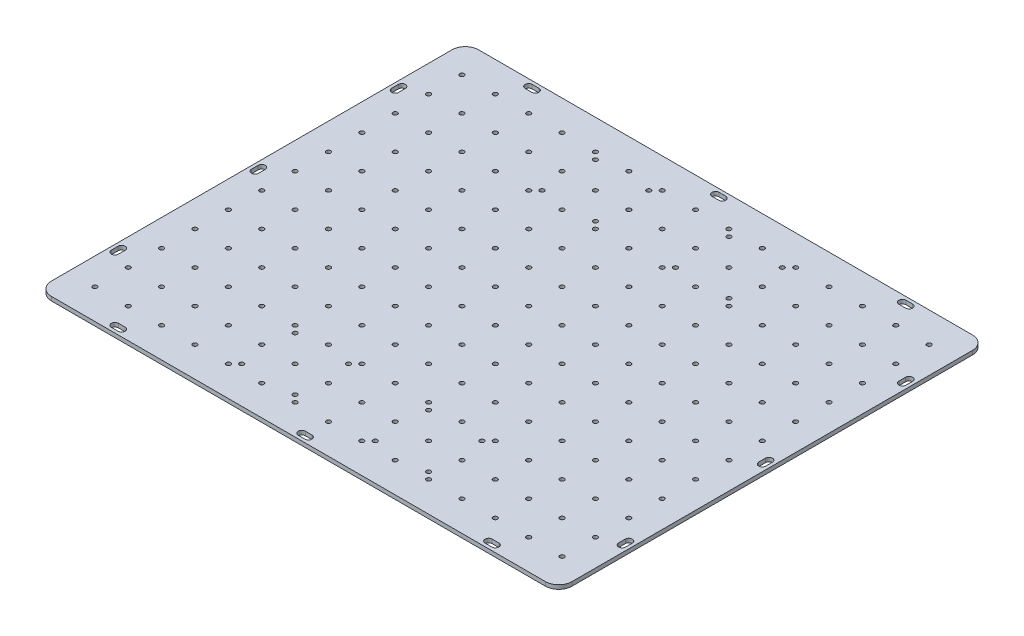
from build123d import *

# Parameters (mm, degrees)
SKETCH1_W           = 390
SKETCH1_H           = 320
BOSS_EXTRUDE1_DEPTH = 3
SKETCH3_R           = 1.65
CUT_EXTRUDE2_DEPTH  = 498.452510296
SKETCH4_R           = 1.65
CUT_EXTRUDE3_DEPTH  = 498.452510296
FILLET1_R           = 10


with BuildPart() as part:
    # Sketch1 → Boss-Extrude1 (new body)
    with BuildSketch(Plane(origin=(0, 0, 0), x_dir=(1, 0, 0), z_dir=(0, 1, 0))):
        with Locations((190, 155)):
            Rectangle(SKETCH1_W, SKETCH1_H)
        with BuildLine():
            Line((52.5, 307.35), (47.5, 307.35))
            ThreePointArc((47.5, 307.35), (44.85, 310), (47.5, 312.65))
            Line((47.5, 312.65), (52.5, 312.65))
            ThreePointArc((52.5, 312.65), (55.15, 310), (52.5, 307.35))
        make_face(mode=Mode.SUBTRACT)
        with BuildLine():
            Line((-2.65, 257.5), (-2.65, 262.5))
            ThreePointArc((-2.65, 262.5), (0, 265.15), (2.65, 262.5))
            Line((2.65, 262.5), (2.65, 257.5))
            ThreePointArc((2.65, 257.5), (0, 254.85), (-2.65, 257.5))
        make_face(mode=Mode.SUBTRACT)
        with BuildLine():
            Line((192.5, 307.35), (187.5, 307.35))
            ThreePointArc((187.5, 307.35), (184.85, 310), (187.5, 312.65))
            Line((187.5, 312.65), (192.5, 312.65))
            ThreePointArc((192.5, 312.65), (195.15, 310), (192.5, 307.35))
        make_face(mode=Mode.SUBTRACT)
        with BuildLine():
            Line((-2.65, 152.5), (-2.65, 157.5))
            ThreePointArc((-2.65, 157.5), (0, 160.15), (2.65, 157.5))
            Line((2.65, 157.5), (2.65, 152.5))
            ThreePointArc((2.65, 152.5), (0, 149.85), (-2.65, 152.5))
        make_face(mode=Mode.SUBTRACT)
        with BuildLine():
            Line((-2.65, 47.5), (-2.65, 52.5))
            ThreePointArc((-2.65, 52.5), (0, 55.15), (2.65, 52.5))
            Line((2.65, 52.5), (2.65, 47.5))
            ThreePointArc((2.65, 47.5), (0, 44.85), (-2.65, 47.5))
        make_face(mode=Mode.SUBTRACT)
        with BuildLine():
            Line((382.65, 257.5), (382.65, 262.5))
            ThreePointArc((382.65, 262.5), (380, 265.15), (377.35, 262.5))
            Line((377.35, 262.5), (377.35, 257.5))
            ThreePointArc((377.35, 257.5), (380, 254.85), (382.65, 257.5))
        make_face(mode=Mode.SUBTRACT)
        with BuildLine():
            Line((382.65, 152.5), (382.65, 157.5))
            ThreePointArc((382.65, 157.5), (380, 160.15), (377.35, 157.5))
            Line((377.35, 157.5), (377.35, 152.5))
            ThreePointArc((377.35, 152.5), (380, 149.85), (382.65, 152.5))
        make_face(mode=Mode.SUBTRACT)
        with BuildLine():
            Line((382.65, 47.5), (382.65, 52.5))
            ThreePointArc((382.65, 52.5), (380, 55.15), (377.35, 52.5))
            Line((377.35, 52.5), (377.35, 47.5))
            ThreePointArc((377.35, 47.5), (380, 44.85), (382.65, 47.5))
        make_face(mode=Mode.SUBTRACT)
        with BuildLine():
            Line((327.5, 307.35), (332.5, 307.35))
            ThreePointArc((332.5, 307.35), (335.15, 310), (332.5, 312.65))
            Line((332.5, 312.65), (327.5, 312.65))
            ThreePointArc((327.5, 312.65), (324.85, 310), (327.5, 307.35))
        make_face(mode=Mode.SUBTRACT)
        with BuildLine():
            Line((52.5, 2.65), (47.5, 2.65))
            ThreePointArc((47.5, 2.65), (44.85, 0), (47.5, -2.65))
            Line((47.5, -2.65), (52.5, -2.65))
            ThreePointArc((52.5, -2.65), (55.15, 0), (52.5, 2.65))
        make_face(mode=Mode.SUBTRACT)
        with BuildLine():
            Line((192.5, 2.65), (187.5, 2.65))
            ThreePointArc((187.5, 2.65), (184.85, 0), (187.5, -2.65))
            Line((187.5, -2.65), (192.5, -2.65))
            ThreePointArc((192.5, -2.65), (195.15, 0), (192.5, 2.65))
        make_face(mode=Mode.SUBTRACT)
        with BuildLine():
            Line((327.5, 2.65), (332.5, 2.65))
            ThreePointArc((332.5, 2.65), (335.15, 0), (332.5, -2.65))
            Line((332.5, -2.65), (327.5, -2.65))
            ThreePointArc((327.5, -2.65), (324.85, 0), (327.5, 2.65))
        make_face(mode=Mode.SUBTRACT)
    extrude(amount=BOSS_EXTRUDE1_DEPTH)

    # Sketch3 → Cut-Extrude2 (cut, through all)
    with BuildSketch(Plane(origin=(0, 3, 0), x_dir=(1, 0, 0), z_dir=(0, 1, 0))):
        with Locations((15, 292.5)):
            Circle(SKETCH3_R)
        with Locations((40, 292.5)):
            Circle(SKETCH3_R)
        with Locations((65, 292.5)):
            Circle(SKETCH3_R)
        with Locations((90, 292.5)):
            Circle(SKETCH3_R)
        with Locations((115, 292.5)):
            Circle(SKETCH3_R)
        with Locations((140, 292.5)):
            Circle(SKETCH3_R)
        with Locations((165, 292.5)):
            Circle(SKETCH3_R)
        with Locations((190, 292.5)):
            Circle(SKETCH3_R)
        with Locations((215, 292.5)):
            Circle(SKETCH3_R)
        with Locations((240, 292.5)):
            Circle(SKETCH3_R)
        with Locations((265, 292.5)):
            Circle(SKETCH3_R)
        with Locations((290, 292.5)):
            Circle(SKETCH3_R)
        with Locations((315, 292.5)):
            Circle(SKETCH3_R)
        with Locations((340, 292.5)):
            Circle(SKETCH3_R)
        with Locations((365, 292.5)):
            Circle(SKETCH3_R)
        with Locations((40, 267.5)):
            Circle(SKETCH3_R)
        with Locations((65, 267.5)):
            Circle(SKETCH3_R)
        with Locations((90, 267.5)):
            Circle(SKETCH3_R)
        with Locations((115, 267.5)):
            Circle(SKETCH3_R)
        with Locations((140, 267.5)):
            Circle(SKETCH3_R)
        with Locations((165, 267.5)):
            Circle(SKETCH3_R)
        with Locations((190, 267.5)):
            Circle(SKETCH3_R)
        with Locations((215, 267.5)):
            Circle(SKETCH3_R)
        with Locations((240, 267.5)):
            Circle(SKETCH3_R)
        with Locations((265, 267.5)):
            Circle(SKETCH3_R)
        with Locations((290, 267.5)):
            Circle(SKETCH3_R)
        with Locations((315, 267.5)):
            Circle(SKETCH3_R)
        with Locations((340, 267.5)):
            Circle(SKETCH3_R)
        with Locations((365, 267.5)):
            Circle(SKETCH3_R)
        with Locations((40, 242.5)):
            Circle(SKETCH3_R)
        with Locations((65, 242.5)):
            Circle(SKETCH3_R)
        with Locations((90, 242.5)):
            Circle(SKETCH3_R)
        with Locations((115, 242.5)):
            Circle(SKETCH3_R)
        with Locations((140, 242.5)):
            Circle(SKETCH3_R)
        with Locations((165, 242.5)):
            Circle(SKETCH3_R)
        with Locations((190, 242.5)):
            Circle(SKETCH3_R)
        with Locations((215, 242.5)):
            Circle(SKETCH3_R)
        with Locations((240, 242.5)):
            Circle(SKETCH3_R)
        with Locations((265, 242.5)):
            Circle(SKETCH3_R)
        with Locations((290, 242.5)):
            Circle(SKETCH3_R)
        with Locations((315, 242.5)):
            Circle(SKETCH3_R)
        with Locations((340, 242.5)):
            Circle(SKETCH3_R)
        with Locations((365, 242.5)):
            Circle(SKETCH3_R)
        with Locations((40, 217.5)):
            Circle(SKETCH3_R)
        with Locations((65, 217.5)):
            Circle(SKETCH3_R)
        with Locations((90, 217.5)):
            Circle(SKETCH3_R)
        with Locations((115, 217.5)):
            Circle(SKETCH3_R)
        with Locations((140, 217.5)):
            Circle(SKETCH3_R)
        with Locations((165, 217.5)):
            Circle(SKETCH3_R)
        with Locations((190, 217.5)):
            Circle(SKETCH3_R)
        with Locations((215, 217.5)):
            Circle(SKETCH3_R)
        with Locations((240, 217.5)):
            Circle(SKETCH3_R)
        with Locations((265, 217.5)):
            Circle(SKETCH3_R)
        with Locations((290, 217.5)):
            Circle(SKETCH3_R)
        with Locations((315, 217.5)):
            Circle(SKETCH3_R)
        with Locations((340, 217.5)):
            Circle(SKETCH3_R)
        with Locations((365, 217.5)):
            Circle(SKETCH3_R)
        with Locations((40, 192.5)):
            Circle(SKETCH3_R)
        with Locations((65, 192.5)):
            Circle(SKETCH3_R)
        with Locations((90, 192.5)):
            Circle(SKETCH3_R)
        with Locations((115, 192.5)):
            Circle(SKETCH3_R)
        with Locations((140, 192.5)):
            Circle(SKETCH3_R)
        with Locations((165, 192.5)):
            Circle(SKETCH3_R)
        with Locations((190, 192.5)):
            Circle(SKETCH3_R)
        with Locations((215, 192.5)):
            Circle(SKETCH3_R)
        with Locations((240, 192.5)):
            Circle(SKETCH3_R)
        with Locations((265, 192.5)):
            Circle(SKETCH3_R)
        with Locations((290, 192.5)):
            Circle(SKETCH3_R)
        with Locations((315, 192.5)):
            Circle(SKETCH3_R)
        with Locations((340, 192.5)):
            Circle(SKETCH3_R)
        with Locations((365, 192.5)):
            Circle(SKETCH3_R)
        with Locations((40, 167.5)):
            Circle(SKETCH3_R)
        with Locations((65, 167.5)):
            Circle(SKETCH3_R)
        with Locations((90, 167.5)):
            Circle(SKETCH3_R)
        with Locations((115, 167.5)):
            Circle(SKETCH3_R)
        with Locations((140, 167.5)):
            Circle(SKETCH3_R)
        with Locations((165, 167.5)):
            Circle(SKETCH3_R)
        with Locations((190, 167.5)):
            Circle(SKETCH3_R)
        with Locations((215, 167.5)):
            Circle(SKETCH3_R)
        with Locations((240, 167.5)):
            Circle(SKETCH3_R)
        with Locations((265, 167.5)):
            Circle(SKETCH3_R)
        with Locations((290, 167.5)):
            Circle(SKETCH3_R)
        with Locations((315, 167.5)):
            Circle(SKETCH3_R)
        with Locations((340, 167.5)):
            Circle(SKETCH3_R)
        with Locations((365, 167.5)):
            Circle(SKETCH3_R)
        with Locations((40, 142.5)):
            Circle(SKETCH3_R)
        with Locations((65, 142.5)):
            Circle(SKETCH3_R)
        with Locations((90, 142.5)):
            Circle(SKETCH3_R)
        with Locations((115, 142.5)):
            Circle(SKETCH3_R)
        with Locations((140, 142.5)):
            Circle(SKETCH3_R)
        with Locations((165, 142.5)):
            Circle(SKETCH3_R)
        with Locations((190, 142.5)):
            Circle(SKETCH3_R)
        with Locations((215, 142.5)):
            Circle(SKETCH3_R)
        with Locations((240, 142.5)):
            Circle(SKETCH3_R)
        with Locations((265, 142.5)):
            Circle(SKETCH3_R)
        with Locations((290, 142.5)):
            Circle(SKETCH3_R)
        with Locations((315, 142.5)):
            Circle(SKETCH3_R)
        with Locations((340, 142.5)):
            Circle(SKETCH3_R)
        with Locations((365, 142.5)):
            Circle(SKETCH3_R)
        with Locations((40, 117.5)):
            Circle(SKETCH3_R)
        with Locations((65, 117.5)):
            Circle(SKETCH3_R)
        with Locations((90, 117.5)):
            Circle(SKETCH3_R)
        with Locations((115, 117.5)):
            Circle(SKETCH3_R)
        with Locations((140, 117.5)):
            Circle(SKETCH3_R)
        with Locations((165, 117.5)):
            Circle(SKETCH3_R)
        with Locations((190, 117.5)):
            Circle(SKETCH3_R)
        with Locations((215, 117.5)):
            Circle(SKETCH3_R)
        with Locations((240, 117.5)):
            Circle(SKETCH3_R)
        with Locations((265, 117.5)):
            Circle(SKETCH3_R)
        with Locations((290, 117.5)):
            Circle(SKETCH3_R)
        with Locations((315, 117.5)):
            Circle(SKETCH3_R)
        with Locations((340, 117.5)):
            Circle(SKETCH3_R)
        with Locations((365, 117.5)):
            Circle(SKETCH3_R)
        with Locations((40, 92.5)):
            Circle(SKETCH3_R)
        with Locations((65, 92.5)):
            Circle(SKETCH3_R)
        with Locations((90, 92.5)):
            Circle(SKETCH3_R)
        with Locations((115, 92.5)):
            Circle(SKETCH3_R)
        with Locations((140, 92.5)):
            Circle(SKETCH3_R)
        with Locations((165, 92.5)):
            Circle(SKETCH3_R)
        with Locations((190, 92.5)):
            Circle(SKETCH3_R)
        with Locations((215, 92.5)):
            Circle(SKETCH3_R)
        with Locations((240, 92.5)):
            Circle(SKETCH3_R)
        with Locations((265, 92.5)):
            Circle(SKETCH3_R)
        with Locations((290, 92.5)):
            Circle(SKETCH3_R)
        with Locations((315, 92.5)):
            Circle(SKETCH3_R)
        with Locations((340, 92.5)):
            Circle(SKETCH3_R)
        with Locations((365, 92.5)):
            Circle(SKETCH3_R)
        with Locations((40, 67.5)):
            Circle(SKETCH3_R)
        with Locations((65, 67.5)):
            Circle(SKETCH3_R)
        with Locations((90, 67.5)):
            Circle(SKETCH3_R)
        with Locations((115, 67.5)):
            Circle(SKETCH3_R)
        with Locations((140, 67.5)):
            Circle(SKETCH3_R)
        with Locations((165, 67.5)):
            Circle(SKETCH3_R)
        with Locations((190, 67.5)):
            Circle(SKETCH3_R)
        with Locations((215, 67.5)):
            Circle(SKETCH3_R)
        with Locations((240, 67.5)):
            Circle(SKETCH3_R)
        with Locations((265, 67.5)):
            Circle(SKETCH3_R)
        with Locations((290, 67.5)):
            Circle(SKETCH3_R)
        with Locations((315, 67.5)):
            Circle(SKETCH3_R)
        with Locations((340, 67.5)):
            Circle(SKETCH3_R)
        with Locations((365, 67.5)):
            Circle(SKETCH3_R)
        with Locations((40, 42.5)):
            Circle(SKETCH3_R)
        with Locations((65, 42.5)):
            Circle(SKETCH3_R)
        with Locations((90, 42.5)):
            Circle(SKETCH3_R)
        with Locations((115, 42.5)):
            Circle(SKETCH3_R)
        with Locations((140, 42.5)):
            Circle(SKETCH3_R)
        with Locations((165, 42.5)):
            Circle(SKETCH3_R)
        with Locations((190, 42.5)):
            Circle(SKETCH3_R)
        with Locations((215, 42.5)):
            Circle(SKETCH3_R)
        with Locations((240, 42.5)):
            Circle(SKETCH3_R)
        with Locations((265, 42.5)):
            Circle(SKETCH3_R)
        with Locations((290, 42.5)):
            Circle(SKETCH3_R)
        with Locations((315, 42.5)):
            Circle(SKETCH3_R)
        with Locations((340, 42.5)):
            Circle(SKETCH3_R)
        with Locations((365, 42.5)):
            Circle(SKETCH3_R)
        with Locations((40, 17.5)):
            Circle(SKETCH3_R)
        with Locations((65, 17.5)):
            Circle(SKETCH3_R)
        with Locations((90, 17.5)):
            Circle(SKETCH3_R)
        with Locations((115, 17.5)):
            Circle(SKETCH3_R)
        with Locations((140, 17.5)):
            Circle(SKETCH3_R)
        with Locations((165, 17.5)):
            Circle(SKETCH3_R)
        with Locations((190, 17.5)):
            Circle(SKETCH3_R)
        with Locations((215, 17.5)):
            Circle(SKETCH3_R)
        with Locations((240, 17.5)):
            Circle(SKETCH3_R)
        with Locations((265, 17.5)):
            Circle(SKETCH3_R)
        with Locations((290, 17.5)):
            Circle(SKETCH3_R)
        with Locations((315, 17.5)):
            Circle(SKETCH3_R)
        with Locations((340, 17.5)):
            Circle(SKETCH3_R)
        with Locations((365, 17.5)):
            Circle(SKETCH3_R)
        with Locations((15, 267.5)):
            Circle(SKETCH3_R)
        with Locations((15, 242.5)):
            Circle(SKETCH3_R)
        with Locations((15, 217.5)):
            Circle(SKETCH3_R)
        with Locations((15, 192.5)):
            Circle(SKETCH3_R)
        with Locations((15, 167.5)):
            Circle(SKETCH3_R)
        with Locations((15, 142.5)):
            Circle(SKETCH3_R)
        with Locations((15, 117.5)):
            Circle(SKETCH3_R)
        with Locations((15, 92.5)):
            Circle(SKETCH3_R)
        with Locations((15, 67.5)):
            Circle(SKETCH3_R)
        with Locations((15, 42.5)):
            Circle(SKETCH3_R)
        with Locations((15, 17.5)):
            Circle(SKETCH3_R)
    extrude(amount=-CUT_EXTRUDE2_DEPTH, mode=Mode.SUBTRACT)

    # Sketch4 → Cut-Extrude3 (cut, through all)
    with BuildSketch(Plane(origin=(0, 3, 0), x_dir=(1, 0, 0), z_dir=(0, 1, 0))):
        with Locations((120, 62.5)):
            Circle(SKETCH4_R)
        with Locations((160, 62.5)):
            Circle(SKETCH4_R)
        with Locations((120, 22.5)):
            Circle(SKETCH4_R)
        with Locations((160, 22.5)):
            Circle(SKETCH4_R)
        with Locations((260, 62.5)):
            Circle(SKETCH4_R)
        with Locations((260, 22.5)):
            Circle(SKETCH4_R)
        with Locations((220, 22.5)):
            Circle(SKETCH4_R)
        with Locations((220, 62.5)):
            Circle(SKETCH4_R)
        with Locations((260, 247.5)):
            Circle(SKETCH4_R)
        with Locations((260, 287.5)):
            Circle(SKETCH4_R)
        with Locations((220, 287.5)):
            Circle(SKETCH4_R)
        with Locations((220, 247.5)):
            Circle(SKETCH4_R)
        with Locations((120, 287.5)):
            Circle(SKETCH4_R)
        with Locations((160, 287.5)):
            Circle(SKETCH4_R)
        with Locations((160, 247.5)):
            Circle(SKETCH4_R)
        with Locations((120, 247.5)):
            Circle(SKETCH4_R)
    extrude(amount=-CUT_EXTRUDE3_DEPTH, mode=Mode.SUBTRACT)

    # Fillet1
    fillet1_edges = [part.edges().sort_by_distance(p)[0] for p in [
        (385, 1.5, -315),
        (385, 1.5, 5),
        (-5, 1.5, 5),
        (-5, 1.5, -315),
    ]]
    fillet(fillet1_edges, radius=FILLET1_R)


solid = part.part
